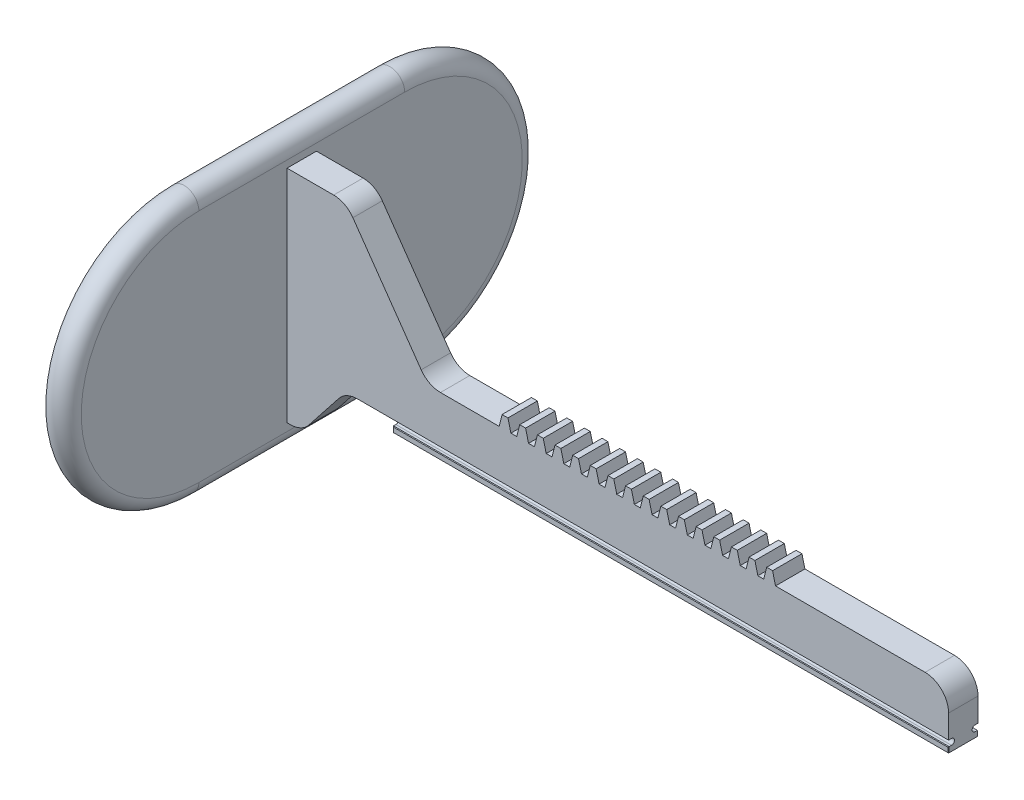
from build123d import *

# Parameters (mm, degrees)
BOSS_EXTRUDE1_DEPTH = 6.35
FILLET1_R           = 5.08
FILLET2_R           = 5.08
FILLET3_R           = 5.08
SKETCH2_W           = 1.27
SKETCH2_H           = 1.27
CUT_EXTRUDE1_DEPTH  = 120.015
FILLET5_R           = 0.635
FILLET6_R           = 0.635
CHAMFER1_SIZE       = 0.127
BOSS_EXTRUDE2_DEPTH = 6.35
SKETCH4_W           = 101.6
SKETCH4_H           = 57.15
BOSS_EXTRUDE3_DEPTH = 6.35
FILLET7_RADIUS      = 28.575
FILLET7_LENGTH      = 6.35
FILLET8_RADIUS      = 28.575
FILLET8_LENGTH      = 6.35
FILLET9_R           = 3.175


with BuildPart() as part:
    # Sketch1 → Boss-Extrude1 (new body)
    with BuildSketch(Plane.XY):
        Polygon((-71.4375, 23.8125), (-58.7375, 23.8125), (-40.9575, -1.5875), (71.4375, -1.5875), (71.4375, -14.2875), (-48.5775, -14.2875), (-48.5775, -11.7475), (-58.7375, -11.7475), (-68.2625, -23.8125), (-71.4375, -23.8125), align=None)
    extrude(amount=BOSS_EXTRUDE1_DEPTH)

    # Fillet1
    fillet1_edges = [part.edges().sort_by_distance(p)[0] for p in [
        (-58.7375, 23.8125, 3.175),
    ]]
    fillet(fillet1_edges, radius=FILLET1_R)

    # Fillet2
    fillet2_edges = [part.edges().sort_by_distance(p)[0] for p in [
        (-40.9575, -1.5875, 3.175),
        (-58.7375, -11.7475, 3.175),
        (-68.2625, -23.8125, 3.175),
    ]]
    fillet(fillet2_edges, radius=FILLET2_R)

    # Fillet3
    fillet3_edges = [part.edges().sort_by_distance(p)[0] for p in [
        (71.4375, -1.5875, 3.175),
    ]]
    fillet(fillet3_edges, radius=FILLET3_R)

    # Sketch2 → Cut-Extrude1 (cut)
    with BuildSketch(Plane(origin=(71.4375, 0, 0), x_dir=(0, 0, -1), z_dir=(1, 0, 0))):
        with Locations((-5.715, -12.3825)):
            Rectangle(SKETCH2_W, SKETCH2_H)
        with Locations((-0.635, -12.3825)):
            Rectangle(SKETCH2_W, SKETCH2_H)
    extrude(amount=-CUT_EXTRUDE1_DEPTH, mode=Mode.SUBTRACT)

    # Fillet5
    fillet5_edges = [part.edges().sort_by_distance(p)[0] for p in [
        (11.43, -11.7475, 1.27),
        (11.43, -13.0175, 1.27),
    ]]
    fillet(fillet5_edges, radius=FILLET5_R - 0.0001)  # a hair under: the kernel refuses the full size

    # Fillet6
    fillet6_edges = [part.edges().sort_by_distance(p)[0] for p in [
        (11.43, -11.7475, 5.08),
        (11.43, -13.0175, 5.08),
    ]]
    fillet(fillet6_edges, radius=FILLET6_R - 0.0001)  # a hair under: the kernel refuses the full size

    # Chamfer1
    chamfer1_edges = [part.edges().sort_by_distance(p)[0] for p in [
        (71.4375, -13.6525, 0),
        (11.43, -14.2875, 0),
        (71.4375, -14.2875, 3.175),
        (11.43, -14.2875, 6.35),
        (71.4375, -13.6525, 6.35),
        (-48.5775, -13.6525, 0),
        (-48.5775, -13.6525, 6.35),
        (11.43, -13.0175, 6.35),
        (11.43, -13.0175, 0),
    ]]
    chamfer(chamfer1_edges, length=CHAMFER1_SIZE)

    # Sketch3 → Boss-Extrude2 (add)
    with BuildSketch(Plane.XY.offset(6.35)):
        Polygon((-18.01675216, -1.5875), (-15.47675216, -1.5875), (-16.11175216, 0.9525), (-17.38175216, 0.9525), align=None)
        Polygon((5.47824784, 0.9525), (4.84324784, -1.5875), (7.38324784, -1.5875), (6.74824784, 0.9525), align=None)
        Polygon((-25.63675216, -1.5875), (-25.00175216, 0.9525), (-23.73175216, 0.9525), (-23.09675216, -1.5875), align=None)
        Polygon((-21.82675216, -1.5875), (-21.19175216, 0.9525), (-19.92175216, 0.9525), (-19.28675216, -1.5875), align=None)
        Polygon((-12.30175216, 0.9525), (-11.66675216, -1.5875), (-14.20675216, -1.5875), (-13.57175216, 0.9525), align=None)
        Polygon((-8.49175216, 0.9525), (-7.85675216, -1.5875), (-10.39675216, -1.5875), (-9.76175216, 0.9525), align=None)
        Polygon((-4.68175216, 0.9525), (-4.04675216, -1.5875), (-6.58675216, -1.5875), (-5.95175216, 0.9525), align=None)
        Polygon((-2.77675216, -1.5875), (-2.14175216, 0.9525), (-0.87175216, 0.9525), (-0.23675216, -1.5875), align=None)
        Polygon((2.93824784, 0.9525), (3.57324784, -1.5875), (1.03324784, -1.5875), (1.66824784, 0.9525), align=None)
        Polygon((10.55824784, 0.9525), (11.19324784, -1.5875), (8.65324784, -1.5875), (9.28824784, 0.9525), align=None)
        Polygon((14.36824784, 0.9525), (15.00324784, -1.5875), (12.46324784, -1.5875), (13.09824784, 0.9525), align=None)
        Polygon((18.17824784, 0.9525), (18.81324784, -1.5875), (16.27324784, -1.5875), (16.90824784, 0.9525), align=None)
        Polygon((21.98824784, 0.9525), (22.62324784, -1.5875), (20.08324784, -1.5875), (20.71824784, 0.9525), align=None)
        Polygon((25.79824784, 0.9525), (26.43324784, -1.5875), (23.89324784, -1.5875), (24.52824784, 0.9525), align=None)
        Polygon((27.70324784, -1.5875), (28.33824784, 0.9525), (29.60824784, 0.9525), (30.24324784, -1.5875), align=None)
        Polygon((33.41824784, 0.9525), (34.05324784, -1.5875), (31.51324784, -1.5875), (32.14824784, 0.9525), align=None)
    extrude(amount=-BOSS_EXTRUDE2_DEPTH)


with BuildPart() as body_2:
    # Sketch4 → Boss-Extrude3 (new body)
    with BuildSketch(Plane.ZY.offset(71.4375)):
        with Locations((3.175, -0.0635)):
            Rectangle(SKETCH4_W, SKETCH4_H)
    extrude(amount=BOSS_EXTRUDE3_DEPTH)

    # Fillet7: full round fillet: the end face becomes a half cylinder, R = half its width
    fillet7_face = Plane((-74.6125, -0.0635, -47.625), x_dir=(-1, 0, 0), z_dir=(0, 0, -1))  # on the end face: x along it, z out of the body
    fillet7_slab = fillet7_face.offset(-FILLET7_RADIUS / 2) * Box(FILLET7_LENGTH, 2 * FILLET7_RADIUS, FILLET7_RADIUS, mode=Mode.PRIVATE)  # the body's end, R deep
    fillet7_round = Plane((-74.6125, -0.0635, -19.05), x_dir=(0, 0, -1), z_dir=(-1, 0, 0)) * Cylinder(FILLET7_RADIUS, FILLET7_LENGTH, mode=Mode.PRIVATE)  # its axis R under the face
    add(fillet7_slab - fillet7_round, mode=Mode.SUBTRACT)

    # Fillet8: full round fillet: the end face becomes a half cylinder, R = half its width
    fillet8_face = Plane((-74.6125, -0.0635, 53.975), x_dir=(1, 0, 0), z_dir=(0, 0, 1))  # on the end face: x along it, z out of the body
    fillet8_slab = fillet8_face.offset(-FILLET8_RADIUS / 2) * Box(FILLET8_LENGTH, 2 * FILLET8_RADIUS, FILLET8_RADIUS, mode=Mode.PRIVATE)  # the body's end, R deep
    fillet8_round = Plane((-74.6125, -0.0635, 25.4), x_dir=(0, 0, 1), z_dir=(1, 0, 0)) * Cylinder(FILLET8_RADIUS, FILLET8_LENGTH, mode=Mode.PRIVATE)  # its axis R under the face
    add(fillet8_slab - fillet8_round, mode=Mode.SUBTRACT)

    # Fillet9
    fillet9_edges = [body_2.edges().sort_by_distance(p)[0] for p in [
        (-71.4375, -28.6385, 3.175),
        (-77.7875, -28.6385, 3.175),
        (-71.4375, -0.0635, -47.625),
        (-71.4375, 28.5115, 3.175),
        (-77.7875, 28.5115, 3.175),
        (-77.7875, -0.0635, 53.975),
    ]]
    fillet(fillet9_edges, radius=FILLET9_R - 0.0001)  # a hair under: the kernel refuses the full size


solid = Compound([part.part, body_2.part])
